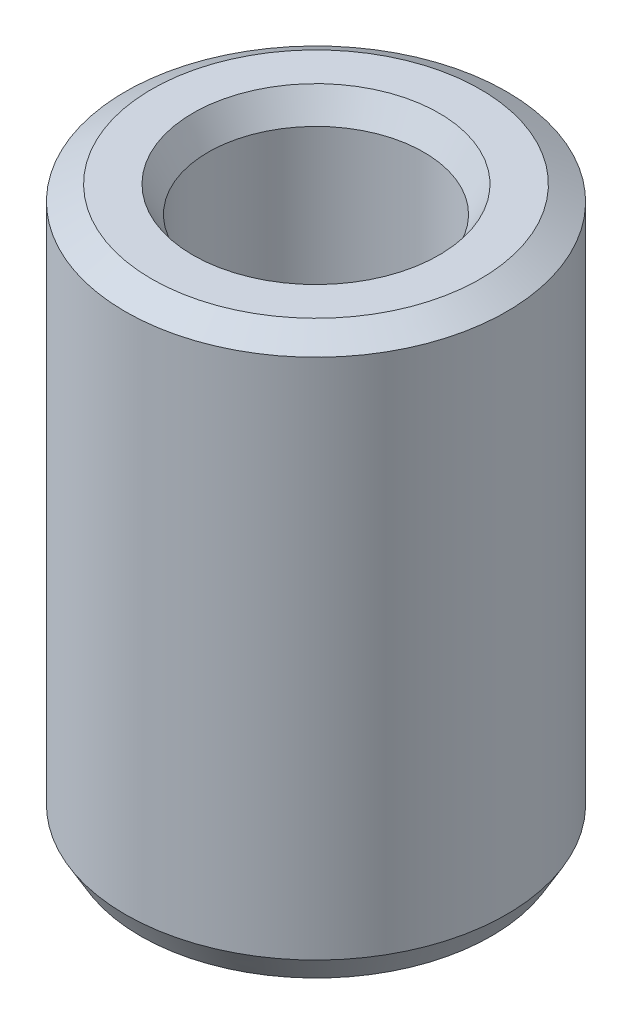
from build123d import *
from OCP.BRepFilletAPI import BRepFilletAPI_MakeChamfer

# Parameters (mm, degrees)
SKETCH1_R           = 7.5
BOSS_EXTRUDE1_DEPTH = 22.169490234
SKETCH2_R           = 4.244357416
CUT_EXTRUDE1_DEPTH  = 25.576132675
CHAMFER1_SIZE       = 0.597154007
CHAMFER1_SIZE2      = 1.034301081


with BuildPart() as part:
    # Sketch1 → Boss-Extrude1 (new body)
    with BuildSketch(Plane(origin=(0, 0, 0), x_dir=(1, 0, 0), z_dir=(0, 1, 0))):
        Circle(SKETCH1_R)
    extrude(amount=BOSS_EXTRUDE1_DEPTH)

    # Sketch2 → Cut-Extrude1 (cut, through all)
    with BuildSketch(Plane(origin=(0, 0, 0), x_dir=(1, 0, 0), z_dir=(0, 1, 0))):
        Circle(SKETCH2_R)
    extrude(amount=CUT_EXTRUDE1_DEPTH, mode=Mode.SUBTRACT)

    # Chamfer1: one chamfer whose edges measure the first distance from different faces: ONE call of the kernel's chamfer builder (chamfer() names one face for all edges)
    chamfer1_edges_1 = [part.edges().sort_by_distance(p)[0] for p in [
        (-4.244357416, 22.169490234, 0),
    ]]
    chamfer1_side_1 = [part.faces().sort_by_distance(p)[0] for p in [
        (-7.287867966, 22.169490234, 0),
    ]]
    chamfer1_edges_2 = [part.edges().sort_by_distance(p)[0] for p in [
        (-4.244357416, 0, 0),
    ]]
    chamfer1_side_2 = [part.faces().sort_by_distance(p)[0] for p in [
        (-4.244357416, 11.084745117, 0),
    ]]
    chamfer1_edges_3 = [part.edges().sort_by_distance(p)[0] for p in [
        (-7.5, 0, 0),
    ]]
    chamfer1_side_3 = [part.faces().sort_by_distance(p)[0] for p in [
        (-7.287867966, 0, 0),
    ]]
    chamfer1_edges_4 = [part.edges().sort_by_distance(p)[0] for p in [
        (-7.5, 22.169490234, 0),
    ]]
    chamfer1_side_4 = [part.faces().sort_by_distance(p)[0] for p in [
        (-7.5, 11.084745117, 0),
    ]]
    chamfer1 = BRepFilletAPI_MakeChamfer(part.part.solid().wrapped)
    for e in chamfer1_edges_1:
        chamfer1.Add(CHAMFER1_SIZE, CHAMFER1_SIZE2, e.wrapped, chamfer1_side_1[0].wrapped)  # the first distance lies on this face
    for e in chamfer1_edges_2:
        chamfer1.Add(CHAMFER1_SIZE, CHAMFER1_SIZE2, e.wrapped, chamfer1_side_2[0].wrapped)  # the first distance lies on this face
    for e in chamfer1_edges_3:
        chamfer1.Add(CHAMFER1_SIZE, CHAMFER1_SIZE2, e.wrapped, chamfer1_side_3[0].wrapped)  # the first distance lies on this face
    for e in chamfer1_edges_4:
        chamfer1.Add(CHAMFER1_SIZE, CHAMFER1_SIZE2, e.wrapped, chamfer1_side_4[0].wrapped)  # the first distance lies on this face
    add(Compound.cast(chamfer1.Shape()), mode=Mode.REPLACE)


solid = part.part
